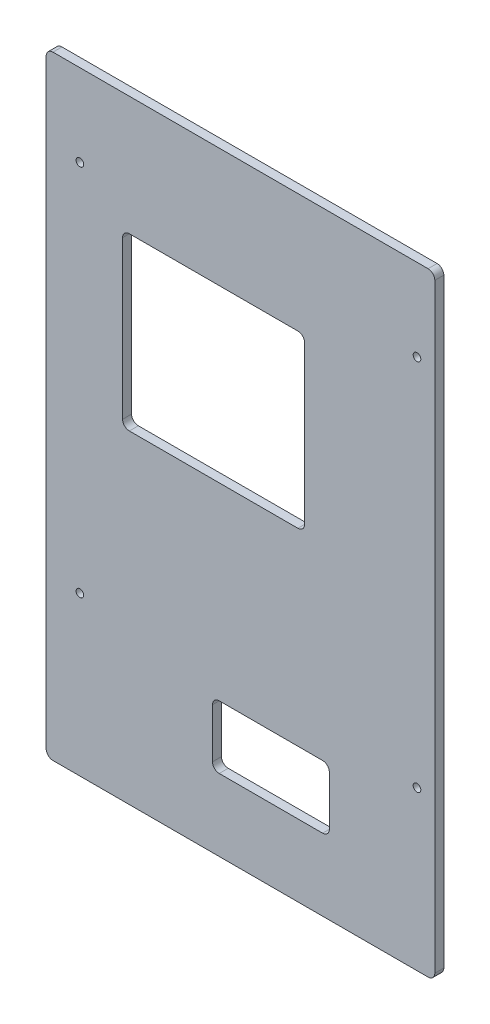
from build123d import *

# Parameters (mm, degrees)
ESQUISSE1_W        = 172.93
ESQUISSE1_H        = 273
ESQUISSE1_R        = 1.5
ESQUISSE1_W_2      = 52
ESQUISSE1_H_2      = 28
ESQUISSE1_W_3      = 81
ESQUISSE1_H_3      = 76
BOSS_EXTRU_1_DEPTH = 4
D_GAGEMENT_M31_D   = 3.4
CONG_1_R           = 3


with BuildPart() as part:
    # Esquisse1 → Boss.-Extru.1 (new body)
    with BuildSketch(Plane.XY):
        with Locations((86.465, 136.5)):
            Rectangle(ESQUISSE1_W, ESQUISSE1_H)
        with Locations((15, 236.5)):
            Circle(ESQUISSE1_R, mode=Mode.SUBTRACT)
        with Locations((165, 236.5)):
            Circle(ESQUISSE1_R, mode=Mode.SUBTRACT)
        with Locations((15, 70.5)):
            Circle(ESQUISSE1_R, mode=Mode.SUBTRACT)
        with Locations((165, 70.5)):
            Circle(ESQUISSE1_R, mode=Mode.SUBTRACT)
        with Locations((100, 46)):
            Rectangle(ESQUISSE1_W_2, ESQUISSE1_H_2, mode=Mode.SUBTRACT)
        with Locations((74.5, 182)):
            Rectangle(ESQUISSE1_W_3, ESQUISSE1_H_3, mode=Mode.SUBTRACT)
    extrude(amount=BOSS_EXTRU_1_DEPTH)

    # Dégagement M31 (through all)
    with Locations(Plane.XY.offset(4)):
        with Locations((15, 236.5), (15, 70.5), (165, 236.5), (165, 70.5)):
            Hole(D_GAGEMENT_M31_D / 2)

    # Congé1
    cong_1_edges = [part.edges().sort_by_distance(p)[0] for p in [
        (0, 0, 2),
        (172.93, 0, 2),
        (126, 32, 2),
        (74, 32, 2),
        (126, 60, 2),
        (74, 60, 2),
        (115, 144, 2),
        (34, 144, 2),
        (115, 220, 2),
        (34, 220, 2),
        (172.93, 273, 2),
        (0, 273, 2),
    ]]
    fillet(cong_1_edges, radius=CONG_1_R)


solid = part.part
